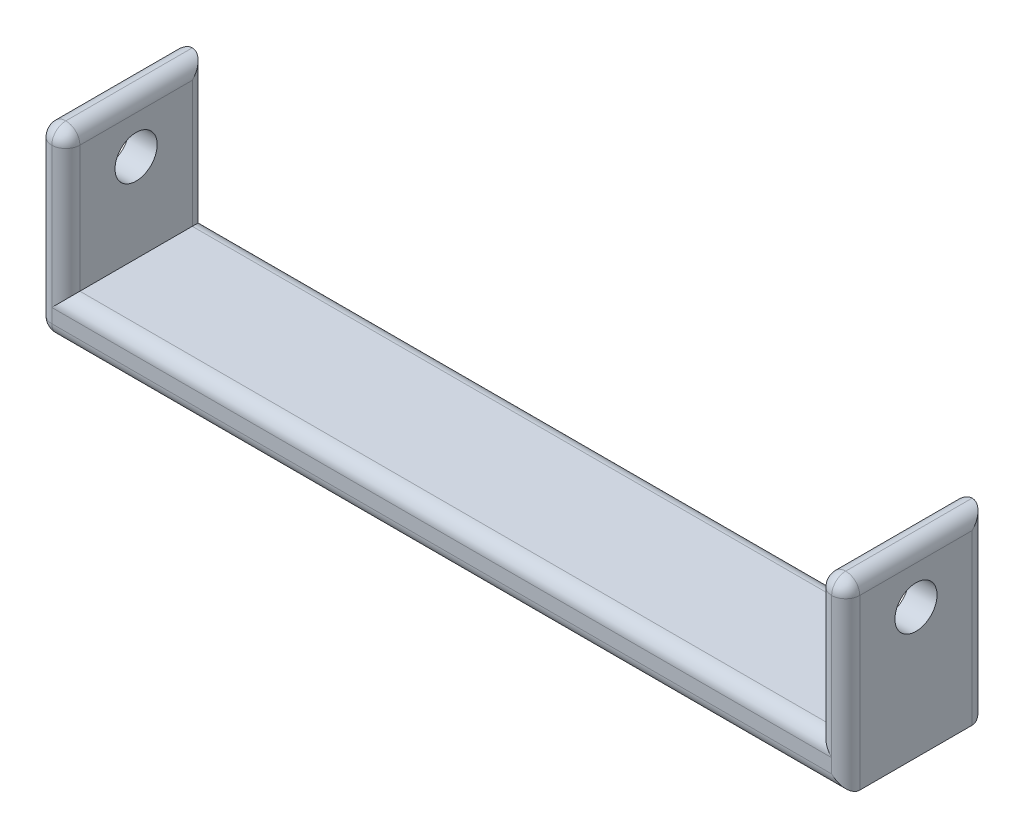
from build123d import *

# Parameters (mm, degrees)
SKETCH1_W           = 57.5
SKETCH1_H           = 10
BOSS_EXTRUDE1_DEPTH = 3
SKETCH2_W           = 2
SKETCH2_H           = 10
BOSS_EXTRUDE2_DEPTH = 10
SKETCH3_R           = 1.5
CUT_EXTRUDE1_DEPTH  = 60.162910679
FILLET1_R           = 1


with BuildPart() as part:
    # Sketch1 → Boss-Extrude1 (new body)
    with BuildSketch(Plane(origin=(0, 0, 0), x_dir=(1, 0, 0), z_dir=(0, 1, 0))):
        Rectangle(SKETCH1_W, SKETCH1_H)
    extrude(amount=BOSS_EXTRUDE1_DEPTH)

    # Sketch2 → Boss-Extrude2 (add)
    with BuildSketch(Plane(origin=(0, 3, 0), x_dir=(1, 0, 0), z_dir=(0, 1, 0))):
        with Locations((-27.75, 0)):
            Rectangle(SKETCH2_W, SKETCH2_H)
        with Locations((27.75, 0)):
            Rectangle(SKETCH2_W, SKETCH2_H)
    extrude(amount=BOSS_EXTRUDE2_DEPTH)

    # Sketch3 → Cut-Extrude1 (cut, through all)
    with BuildSketch(Plane.ZY.offset(28.75)):
        with Locations((0, 9.287412426)):
            Circle(SKETCH3_R)
    extrude(amount=-CUT_EXTRUDE1_DEPTH, mode=Mode.SUBTRACT)

    # Fillet1
    fillet1_edges = [part.edges().sort_by_distance(p)[0] for p in [
        (0, 3, 5),
        (-26.75, 8, 5),
        (-26.75, 8, -5),
        (-28.75, 13, 0),
        (-27.75, 13, 5),
        (-26.75, 13, 0),
        (0, 3, -5),
        (26.75, 8, -5),
        (26.75, 8, 5),
        (28.75, 13, 0),
        (26.75, 13, 0),
        (27.75, 13, 5),
        (0, 0, 5),
        (-28.75, 0, 0),
        (0, 0, -5),
        (28.75, 6.5, 5),
        (-28.75, 6.5, 5),
        (-28.75, 6.5, -5),
        (28.75, 6.5, -5),
    ]]
    fillet(fillet1_edges, radius=FILLET1_R - 0.0001)  # a hair under: the kernel refuses the full size


solid = part.part
